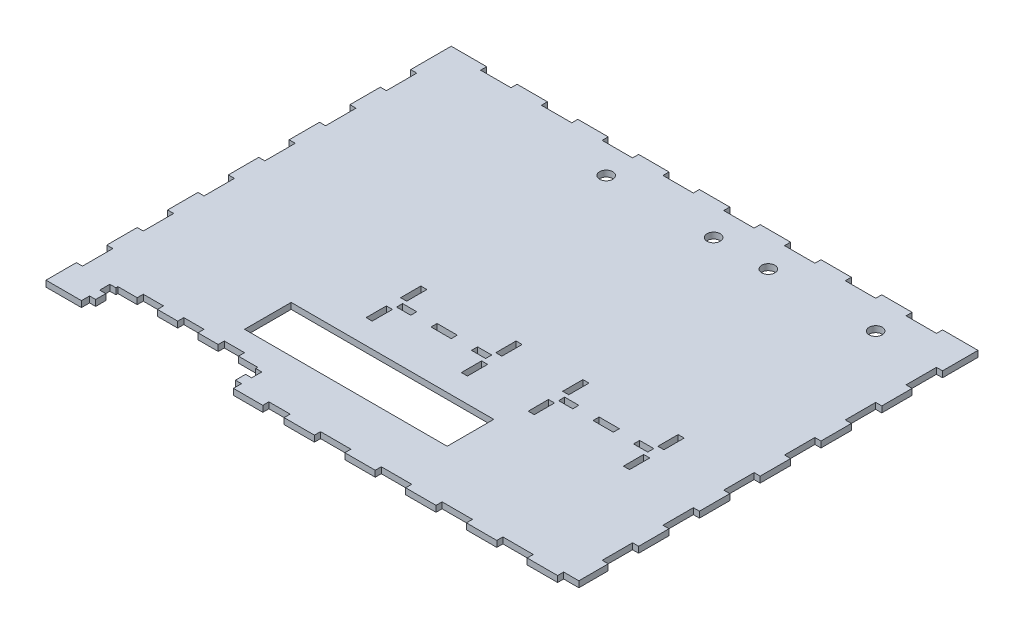
from build123d import *

# Parameters (mm, degrees)
CROQUIS1_R              = 3.25
CROQUIS1_W              = 10
CROQUIS1_H              = 3
CROQUIS1_W_2            = 3
CROQUIS1_H_2            = 10
CROQUIS1_W_3            = 7
SALIENTE_EXTRUIR1_DEPTH = 3


with BuildPart() as part:
    # Croquis1 → Saliente-Extruir1 (new body)
    with BuildSketch(Plane(origin=(0, 0, 0), x_dir=(1, 0, 0), z_dir=(0, 1, 0))):
        Polygon((17.5, 79), (20.5, 79), (20.5, 80), (25.626440042, 80), (30, 80), (30, 83), (40, 83), (40, 80), (50, 80), (50, 83), (60, 83), (60, 80), (70, 80), (70, 83), (80, 83), (80, 80), (84.373559958, 80), (89.5, 80), (89.5, 79), (92.5, 79), (92.5, 74), (89.5, 74), (89.5, 69), (92.5, 69), (92.5, 65), (107, 65), (107, 68), (117.5, 68), (117.5, 65), (132.5, 65), (132.5, 68), (147.5, 68), (147.5, 65), (162.5, 65), (162.5, 68), (177.5, 68), (177.5, 65), (192.5, 65), (192.5, 68), (207.5, 68), (207.5, 65), (222.5, 65), (222.5, 68), (237.5, 68), (237.5, 65), (252.5, 65), (252.5, 68), (260, 68), (260, 82.5), (257, 82.5), (257, 97.5), (260, 97.5), (260, 112.5), (257, 112.5), (257, 127.5), (260, 127.5), (260, 142.5), (257, 142.5), (257, 157.5), (260, 157.5), (260, 172.5), (257, 172.5), (257, 187.5), (260, 187.5), (260, 202.5), (257, 202.5), (257, 217.5), (260, 217.5), (260, 232.5), (257, 232.5), (257, 247.5), (260, 247.5), (260, 265), (242.5, 265), (242.5, 262), (227.5, 262), (227.5, 265), (212.5, 265), (212.5, 262), (197.5, 262), (197.5, 265), (182.5, 265), (182.5, 262), (167.5, 262), (167.5, 265), (152.5, 265), (152.5, 262), (137.5, 262), (137.5, 265), (122.5, 265), (122.5, 262), (107.5, 262), (107.5, 265), (92.5, 265), (92.5, 262), (77.5, 262), (77.5, 265), (62.5, 265), (62.5, 262), (47.5, 262), (47.5, 265), (32.5, 265), (32.5, 262), (17.5, 262), (17.5, 265), (0, 265), (0, 245), (3, 245), (3, 230), (0, 230), (0, 215), (3, 215), (3, 200), (0, 200), (0, 185), (3, 185), (3, 170), (0, 170), (0, 155), (3, 155), (3, 140), (0, 140), (0, 125), (3, 125), (3, 110), (0, 110), (0, 95), (3, 95), (3, 80), (0, 80), (0, 65), (17.5, 65), (17.5, 69), (20.5, 69), (20.5, 74), (17.5, 74), align=None)
        with Locations((173.5, 248)):
            Circle(CROQUIS1_R, mode=Mode.SUBTRACT)
        with Locations((93.5, 248)):
            Circle(CROQUIS1_R, mode=Mode.SUBTRACT)
        with Locations((146.5, 248)):
            Circle(CROQUIS1_R, mode=Mode.SUBTRACT)
        with Locations((226.5, 248)):
            Circle(CROQUIS1_R, mode=Mode.SUBTRACT)
        with Locations((120, 141.5)):
            Rectangle(CROQUIS1_W, CROQUIS1_H, mode=Mode.SUBTRACT)
        Polygon((120, 93), (70, 93), (70, 116), (170, 116), (170, 93), align=None, mode=Mode.SUBTRACT)
        with Locations((200, 141.5)):
            Rectangle(CROQUIS1_W, CROQUIS1_H, mode=Mode.SUBTRACT)
        with Locations((143.5, 133)):
            Rectangle(CROQUIS1_W_2, CROQUIS1_H_2, mode=Mode.SUBTRACT)
        with Locations((101.5, 141.5)):
            Rectangle(CROQUIS1_W_3, CROQUIS1_H, mode=Mode.SUBTRACT)
        with Locations((96.5, 150)):
            Rectangle(CROQUIS1_W_2, CROQUIS1_H_2, mode=Mode.SUBTRACT)
        with Locations((96.5, 133)):
            Rectangle(CROQUIS1_W_2, CROQUIS1_H_2, mode=Mode.SUBTRACT)
        with Locations((143.5, 150)):
            Rectangle(CROQUIS1_W_2, CROQUIS1_H_2, mode=Mode.SUBTRACT)
        with Locations((138.5, 141.5)):
            Rectangle(CROQUIS1_W_3, CROQUIS1_H, mode=Mode.SUBTRACT)
        with Locations((181.5, 141.5)):
            Rectangle(CROQUIS1_W_3, CROQUIS1_H, mode=Mode.SUBTRACT)
        with Locations((223.5, 133)):
            Rectangle(CROQUIS1_W_2, CROQUIS1_H_2, mode=Mode.SUBTRACT)
        with Locations((176.5, 150)):
            Rectangle(CROQUIS1_W_2, CROQUIS1_H_2, mode=Mode.SUBTRACT)
        with Locations((218.5, 141.5)):
            Rectangle(CROQUIS1_W_3, CROQUIS1_H, mode=Mode.SUBTRACT)
        with Locations((223.5, 150)):
            Rectangle(CROQUIS1_W_2, CROQUIS1_H_2, mode=Mode.SUBTRACT)
        with Locations((176.5, 133)):
            Rectangle(CROQUIS1_W_2, CROQUIS1_H_2, mode=Mode.SUBTRACT)
    extrude(amount=SALIENTE_EXTRUIR1_DEPTH)


solid = part.part
